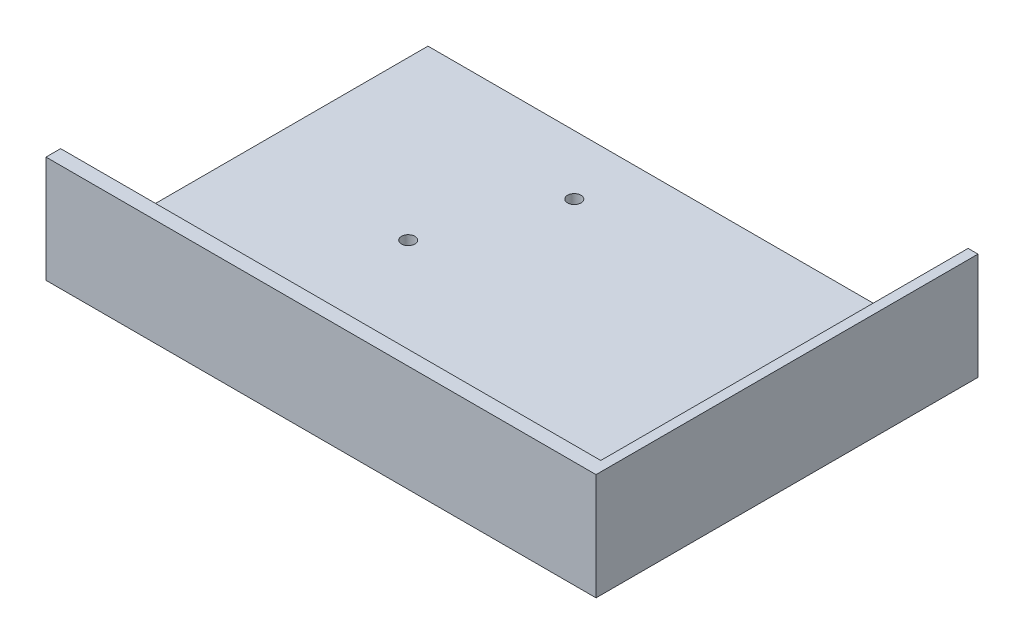
from build123d import *

# Parameters (mm, degrees)
SKETCH1_W                     = 278.2
SKETCH1_H                     = 193.2
SHELL_BLOCK_DEPTH             = 27
SKETCH2_W                     = 273.2
SKETCH2_H                     = 185.8
FRONT_OPENING_DEPTH           = 1.5
SKETCH3_W                     = 273.2
SKETCH3_H                     = 188.2
DISPLAY_POCKET_DEPTH          = 22.5
SKETCH4_W                     = 3
SKETCH4_H                     = 56
VENT_SLOTS_DEPTH              = 4
SKETCH5_W                     = 58
SKETCH5_H                     = 16
CABLE_EXIT_X_SHORT_SIDE_DEPTH = 140.1
SKETCH6_R                     = 1.7
BOLT_HOLES_DEPTH              = 4
KEEP_ONE_HALF_X_DEPTH         = 172.491603293
KEEP_ONE_HALF_X_DEPTH_BACK    = 172.491603293
SKETCH7_W                     = 200
SKETCH7_H                     = 400
KEEP_ONE_QUARTER_Z_DEPTH      = 172.491603293
KEEP_ONE_QUARTER_Z_DEPTH_BACK = 172.491603293
SKETCH8_W                     = 400
SKETCH8_H                     = 200


with BuildPart() as part:
    # Sketch1 → Shell Block (new body)
    with BuildSketch(Plane(origin=(0, 0, 0), x_dir=(1, 0, 0), z_dir=(0, 1, 0))):
        Rectangle(SKETCH1_W, SKETCH1_H)
    extrude(amount=SHELL_BLOCK_DEPTH)

    # Sketch2 → Front Opening (cut)
    with BuildSketch(Plane(origin=(0, 27, 0), x_dir=(1, 0, 0), z_dir=(0, 1, 0))):
        Rectangle(SKETCH2_W, SKETCH2_H)
    extrude(amount=-FRONT_OPENING_DEPTH, mode=Mode.SUBTRACT)

    # Sketch3 → Display Pocket (cut)
    with BuildSketch(Plane(origin=(0, 25.5, 0), x_dir=(1, 0, 0), z_dir=(0, 1, 0))):
        Rectangle(SKETCH3_W, SKETCH3_H)
    extrude(amount=-DISPLAY_POCKET_DEPTH, mode=Mode.SUBTRACT)

    # Sketch4 → Vent Slots (cut)
    with BuildSketch(Plane(origin=(0, 3, 0), x_dir=(1, 0, 0), z_dir=(0, 1, 0))):
        with Locations((-67.5, 56)):
            Rectangle(SKETCH4_W, SKETCH4_H)
        with Locations((-67.5, -56)):
            Rectangle(SKETCH4_W, SKETCH4_H)
        with Locations((-75.5, 56)):
            Rectangle(SKETCH4_W, SKETCH4_H)
        with Locations((-75.5, -56)):
            Rectangle(SKETCH4_W, SKETCH4_H)
        with Locations((-83.5, 56)):
            Rectangle(SKETCH4_W, SKETCH4_H)
        with Locations((-83.5, -56)):
            Rectangle(SKETCH4_W, SKETCH4_H)
        with Locations((-91.5, 56)):
            Rectangle(SKETCH4_W, SKETCH4_H)
        with Locations((-91.5, -56)):
            Rectangle(SKETCH4_W, SKETCH4_H)
        with Locations((-99.5, 56)):
            Rectangle(SKETCH4_W, SKETCH4_H)
        with Locations((-99.5, -56)):
            Rectangle(SKETCH4_W, SKETCH4_H)
        with Locations((-107.5, 56)):
            Rectangle(SKETCH4_W, SKETCH4_H)
        with Locations((-107.5, -56)):
            Rectangle(SKETCH4_W, SKETCH4_H)
        with Locations((-115.5, 56)):
            Rectangle(SKETCH4_W, SKETCH4_H)
        with Locations((-115.5, -56)):
            Rectangle(SKETCH4_W, SKETCH4_H)
        with Locations((-123.5, 56)):
            Rectangle(SKETCH4_W, SKETCH4_H)
        with Locations((-123.5, -56)):
            Rectangle(SKETCH4_W, SKETCH4_H)
    extrude(amount=-VENT_SLOTS_DEPTH, mode=Mode.SUBTRACT)

    # Sketch5 → Cable Exit (-X short side) (cut)
    with BuildSketch(Plane(origin=(0, 0, 0), x_dir=(0, 0, -1), z_dir=(1, 0, 0))):
        with Locations((0, 13)):
            Rectangle(SKETCH5_W, SKETCH5_H)
    extrude(amount=-CABLE_EXIT_X_SHORT_SIDE_DEPTH, mode=Mode.SUBTRACT)

    # Sketch6 → Bolt Holes (cut)
    with BuildSketch(Plane(origin=(0, 3, 0), x_dir=(1, 0, 0), z_dir=(0, 1, 0))):
        with Locations((-40, -45)):
            Circle(SKETCH6_R)
        with Locations((-40, 45)):
            Circle(SKETCH6_R)
        with Locations((40, -45)):
            Circle(SKETCH6_R)
        with Locations((40, 45)):
            Circle(SKETCH6_R)
        with Locations((-52, -15)):
            Circle(SKETCH6_R)
        with Locations((-52, 15)):
            Circle(SKETCH6_R)
        with Locations((52, -15)):
            Circle(SKETCH6_R)
        with Locations((52, 15)):
            Circle(SKETCH6_R)
        with Locations((-12, -82)):
            Circle(SKETCH6_R)
        with Locations((-12, 82)):
            Circle(SKETCH6_R)
        with Locations((12, -82)):
            Circle(SKETCH6_R)
        with Locations((12, 82)):
            Circle(SKETCH6_R)
        with Locations((-124, -12)):
            Circle(SKETCH6_R)
        with Locations((-124, 12)):
            Circle(SKETCH6_R)
        with Locations((124, -12)):
            Circle(SKETCH6_R)
        with Locations((124, 12)):
            Circle(SKETCH6_R)
    extrude(amount=-BOLT_HOLES_DEPTH, mode=Mode.SUBTRACT)

    # Sketch7 → Keep one half (X) (cut, two sides: drawn at the far end of the back side and taken through both)
    with BuildSketch(Plane(origin=(0, 0, 0), x_dir=(1, 0, 0), z_dir=(0, 1, 0)).offset(-KEEP_ONE_HALF_X_DEPTH_BACK)):
        with Locations((-100, 0)):
            Rectangle(SKETCH7_W, SKETCH7_H)
    extrude(amount=KEEP_ONE_HALF_X_DEPTH + KEEP_ONE_HALF_X_DEPTH_BACK, mode=Mode.SUBTRACT)

    # Sketch8 → Keep one quarter (Z) (cut, two sides: drawn at the far end of the back side and taken through both)
    with BuildSketch(Plane(origin=(0, 0, 0), x_dir=(1, 0, 0), z_dir=(0, 1, 0)).offset(-KEEP_ONE_QUARTER_Z_DEPTH_BACK)):
        with Locations((0, 100)):
            Rectangle(SKETCH8_W, SKETCH8_H)
    extrude(amount=KEEP_ONE_QUARTER_Z_DEPTH + KEEP_ONE_QUARTER_Z_DEPTH_BACK, mode=Mode.SUBTRACT)


solid = part.part
